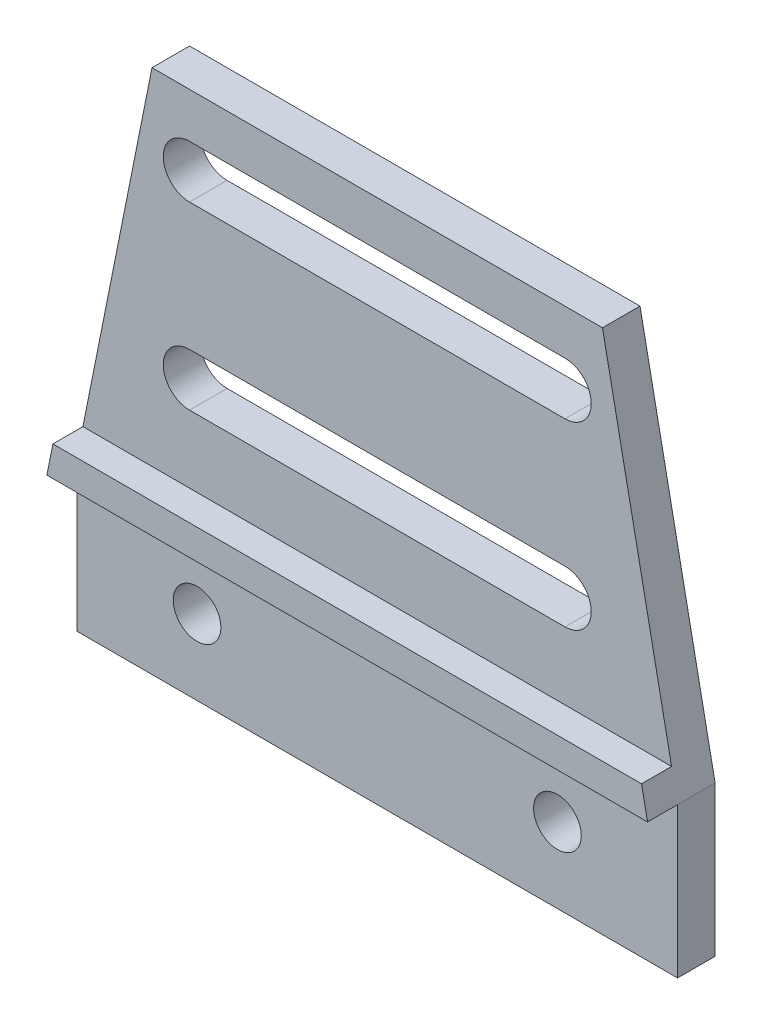
from build123d import *

# Parameters (mm, degrees)
SALIENTE_EXTRUIR1_DEPTH = 2.5
SALIENTE_EXTRUIR2_DEPTH = 2
CROQUIS3_R              = 1.5875
CORTAR_EXTRUIR1_DEPTH   = 12
CORTAR_EXTRUIR2_DEPTH   = 12


with BuildPart() as part:
    # Croquis1 → Saliente-Extruir1 (new body)
    with BuildSketch(Plane.XY):
        Polygon((-20, 5), (-20, -5), (20, -5), (20, 5), (15, 30), (-15, 30), align=None)
    extrude(amount=SALIENTE_EXTRUIR1_DEPTH)

    # Croquis2 → Saliente-Extruir2 (add)
    with BuildSketch(Plane.XY.offset(2.5)):
        Polygon((-19.6, 7), (-20, 5), (20, 5), (19.6, 7), align=None)
    extrude(amount=SALIENTE_EXTRUIR2_DEPTH)

    # Croquis3 → Cortar-Extruir1 (cut)
    with BuildSketch(Plane.XY.offset(2.5)):
        with Locations((-12, 0)):
            Circle(CROQUIS3_R)
        with Locations((12, 0)):
            Circle(CROQUIS3_R)
    extrude(amount=-CORTAR_EXTRUIR1_DEPTH, mode=Mode.SUBTRACT)

    # Croquis4 → Cortar-Extruir2 (cut)
    with BuildSketch(Plane.XY.offset(2.5)):
        with BuildLine():
            Line((-12.5, 27), (12.5, 27))
            ThreePointArc((12.5, 27), (14.25, 25.25), (12.5, 23.5))
            Line((12.5, 23.5), (-12.5, 23.5))
            ThreePointArc((-12.5, 23.5), (-14.25, 25.25), (-12.5, 27))
        make_face()
        with BuildLine():
            Line((-12.5, 11.5), (12.5, 11.5))
            ThreePointArc((12.5, 11.5), (14.25, 13.25), (12.5, 15))
            Line((12.5, 15), (-12.5, 15))
            ThreePointArc((-12.5, 15), (-14.25, 13.25), (-12.5, 11.5))
        make_face()
    extrude(amount=-CORTAR_EXTRUIR2_DEPTH, mode=Mode.SUBTRACT)


solid = part.part
